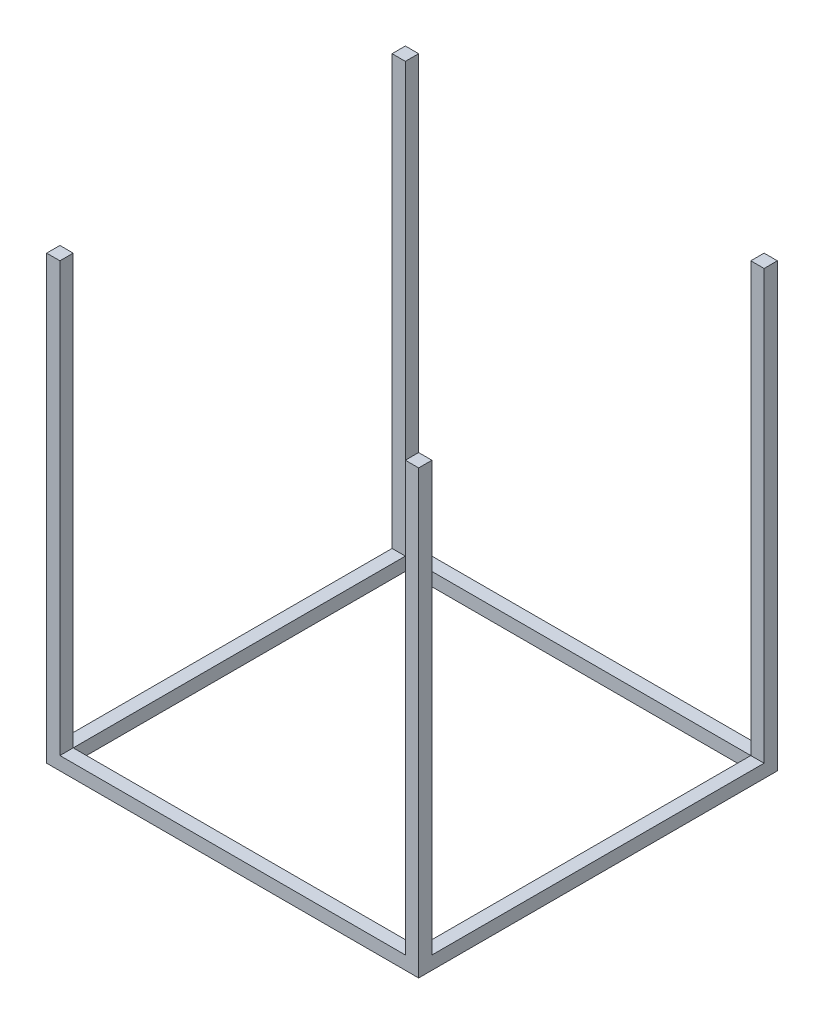
from build123d import *

# Parameters (mm, degrees)
SKETCH1_W           = 1422.4
SKETCH1_H           = 1371.6
SKETCH1_W_2         = 1320.8
SKETCH1_H_2         = 1270
BOSS_EXTRUDE1_DEPTH = 50.8
SKETCH1_3_W         = 50.8
SKETCH1_3_H         = 50.8
BOSS_EXTRUDE2_DEPTH = 1689.1


with BuildPart() as part:
    # Sketch1 → Boss-Extrude1 (new body)
    with BuildSketch(Plane(origin=(0, 0, 0), x_dir=(1, 0, 0), z_dir=(0, 1, 0))):
        Rectangle(SKETCH1_W, SKETCH1_H)
        Rectangle(SKETCH1_W_2, SKETCH1_H_2, mode=Mode.SUBTRACT)
    extrude(amount=BOSS_EXTRUDE1_DEPTH)

    # Sketch1<3> → Boss-Extrude2 (add)
    with BuildSketch(Plane(origin=(0, 0, 0), x_dir=(1, 0, 0), z_dir=(0, 1, 0))):
        with Locations((-685.8, 660.4)):
            Rectangle(SKETCH1_3_W, SKETCH1_3_H)
        with Locations((-685.8, -660.4)):
            Rectangle(SKETCH1_3_W, SKETCH1_3_H)
        with Locations((685.8, 660.4)):
            Rectangle(SKETCH1_3_W, SKETCH1_3_H)
        with Locations((685.8, -660.4)):
            Rectangle(SKETCH1_3_W, SKETCH1_3_H)
    extrude(amount=BOSS_EXTRUDE2_DEPTH)


solid = part.part
